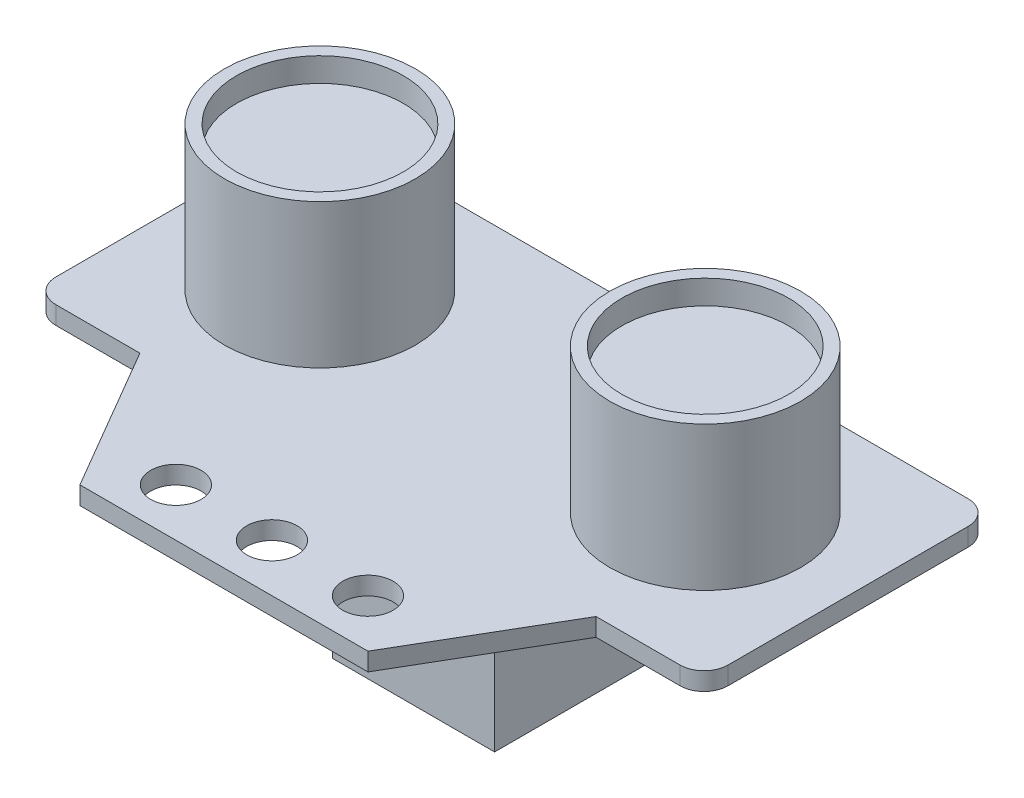
from build123d import *

# Parameters (mm, degrees)
SKETCH1_R           = 2.1
BOSS_EXTRUDE1_DEPTH = 1.5
FILLET1_R           = 2
SKETCH2_R           = 7.95
BOSS_EXTRUDE2_DEPTH = 12
SKETCH3_W           = 13.5
SKETCH3_H           = 16
BOSS_EXTRUDE3_DEPTH = 16.3
SKETCH4_R           = 6.95
CUT_EXTRUDE1_DEPTH  = 2


with BuildPart() as part:
    # Sketch1 → Boss-Extrude1 (new body)
    with BuildSketch(Plane(origin=(0, 0, 0), x_dir=(1, 0, 0), z_dir=(0, 1, 0))):
        Polygon((12, 0), (-12, 0), (-19, 12), (-28, 12), (-28, 36), (28, 36), (28, 12), (19, 12), align=None)
        with Locations((0, 4)):
            Circle(SKETCH1_R, mode=Mode.SUBTRACT)
        with Locations((-8, 4)):
            Circle(SKETCH1_R, mode=Mode.SUBTRACT)
        with Locations((8, 4)):
            Circle(SKETCH1_R, mode=Mode.SUBTRACT)
    extrude(amount=BOSS_EXTRUDE1_DEPTH)

    # Fillet1
    fillet1_edges = [part.edges().sort_by_distance(p)[0] for p in [
        (28, 0.75, -12),
        (28, 0.75, -36),
        (-28, 0.75, -36),
        (-28, 0.75, -12),
    ]]
    fillet(fillet1_edges, radius=FILLET1_R)

    # Sketch2 → Boss-Extrude2 (add)
    with BuildSketch(Plane(origin=(0, 1.5, 0), x_dir=(1, 0, 0), z_dir=(0, 1, 0))):
        with Locations((-16.05, 24.05)):
            Circle(SKETCH2_R)
        with Locations((16.05, 24.05)):
            Circle(SKETCH2_R)
    extrude(amount=BOSS_EXTRUDE2_DEPTH)

    # Sketch3 → Boss-Extrude3 (add)
    with BuildSketch(Plane.XZ):
        with Locations((0, -23.8)):
            Rectangle(SKETCH3_W, SKETCH3_H)
    extrude(amount=BOSS_EXTRUDE3_DEPTH)

    # Sketch4 → Cut-Extrude1 (cut)
    with BuildSketch(Plane(origin=(0, 13.5, 0), x_dir=(1, 0, 0), z_dir=(0, 1, 0))):
        with Locations((-16.05, 24.05)):
            Circle(SKETCH4_R)
        with Locations((16.05, 24.05)):
            Circle(SKETCH4_R)
    extrude(amount=-CUT_EXTRUDE1_DEPTH, mode=Mode.SUBTRACT)


solid = part.part
